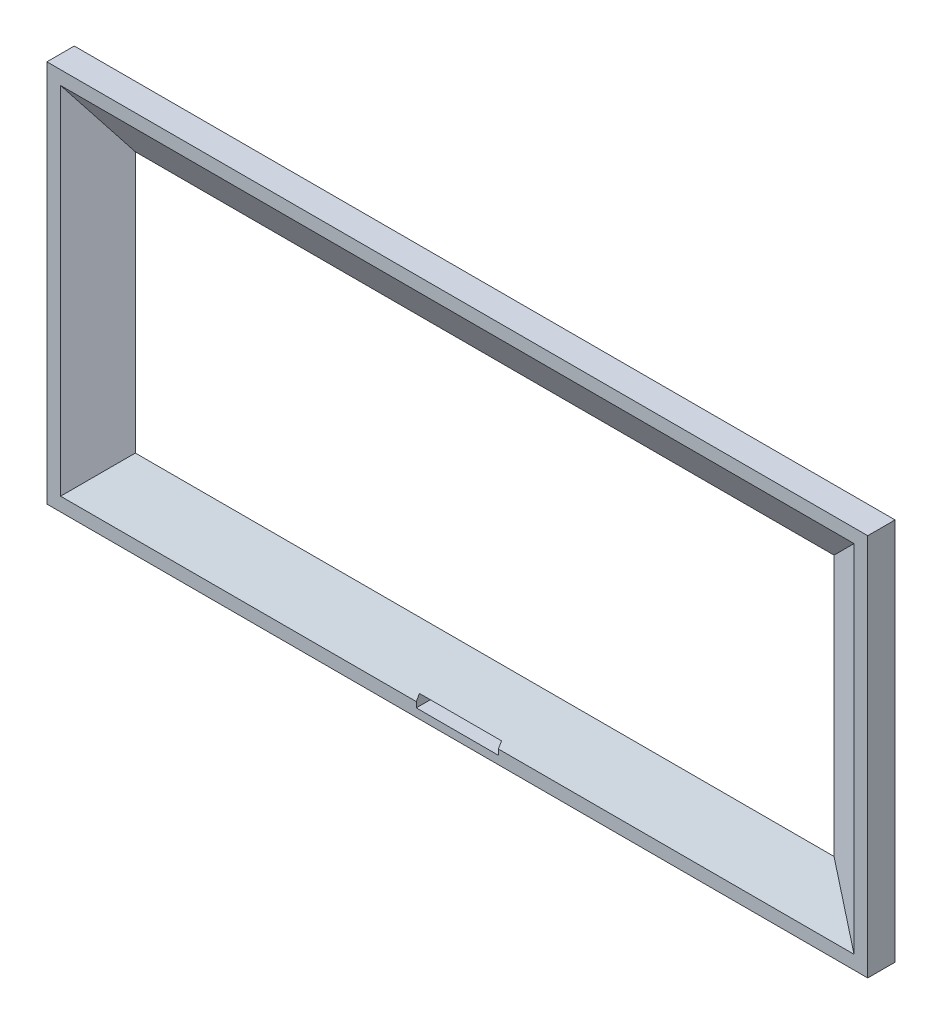
from build123d import *

# Parameters (mm, degrees)
SKETCH1_W           = 300
SKETCH1_H           = 140
SKETCH1_W_2         = 250
SKETCH1_H_2         = 90
BOSS_EXTRUDE1_DEPTH = 10
SKETCH2_W           = 30
SKETCH2_H           = 4
CUT_EXTRUDE1_DEPTH  = 44


with BuildPart() as part:
    # Sketch1 → Boss-Extrude1 (new body)
    with BuildSketch(Plane.XY):
        with Locations((125, 45)):
            Rectangle(SKETCH1_W, SKETCH1_H)
        with Locations((125, 45)):
            Rectangle(SKETCH1_W_2, SKETCH1_H_2, mode=Mode.SUBTRACT)
    extrude(amount=BOSS_EXTRUDE1_DEPTH)

    # Chamfer1
    # the kernel refuses this chamfer: 20, 11.547005384 mm, written as the material it takes off along each edge
    with BuildSketch(Plane(origin=(250, 0, 10), x_dir=(-0.05789386240267053, 0, -0.9983227437537926), z_dir=(0, 1, 0)), Plane(origin=(0, 90, 10), x_dir=(0.05789386240267081, 0, -0.9983227437537926), z_dir=(0, -1, 0))) as chamfer1_piece_1:
        with BuildLine():
            Line((11.967077239, 0), (-1.59731639, -20.634955616))
            Line((-1.59731639, -20.634955616), (-1.996645488, -20.611798071))
            ThreePointArc((-1.996645488, -20.611798071), (-0.998322744, -10.305899035), (-0.399329098, 0.023157545))
            Line((-0.399329098, 0.023157545), (0.023157545, 0.399329098))
            ThreePointArc((0.023157545, 0.399329098), (5.986641142, 0.053499955), (11.990234784, 0.399329098))
            Line((11.990234784, 0.399329098), (11.967077239, 0))
        make_face()
    extrude(amount=90, mode=Mode.SUBTRACT)
    with BuildSketch(Plane(origin=(250, 90, 10), x_dir=(0, -0.05789386240267053, -0.9983227437537926), z_dir=(-1, 0, 0)), Plane(origin=(0, 0, 10), x_dir=(0, 0.05789386240267081, -0.9983227437537926), z_dir=(1, 0, 0))) as chamfer1_piece_2:
        with BuildLine():
            Line((11.967077239, 0), (-1.59731639, -20.634955616))
            Line((-1.59731639, -20.634955616), (-1.996645488, -20.611798071))
            ThreePointArc((-1.996645488, -20.611798071), (-0.998322744, -10.305899035), (-0.399329098, 0.023157545))
            Line((-0.399329098, 0.023157545), (0.023157545, 0.399329098))
            ThreePointArc((0.023157545, 0.399329098), (5.986641142, 0.053499955), (11.990234784, 0.399329098))
            Line((11.990234784, 0.399329098), (11.967077239, 0))
        make_face()
    extrude(amount=250, mode=Mode.SUBTRACT)
    with BuildSketch(Plane(origin=(250, -51.741715093, 10), x_dir=(-0.05789386240267053, 0, -0.9983227437537926), z_dir=(0, 1, 0))) as chamfer1_piece_3a_section:
        with BuildLine():
            Line((11.967077239, 0), (-1.59731639, -20.634955616))
            Line((-1.59731639, -20.634955616), (-1.996645488, -20.611798071))
            ThreePointArc((-1.996645488, -20.611798071), (-0.998322744, -10.305899035), (-0.399329098, 0.023157545))
            Line((-0.399329098, 0.023157545), (0.023157545, 0.399329098))
            ThreePointArc((0.023157545, 0.399329098), (5.986641142, 0.053499955), (11.990234784, 0.399329098))
            Line((11.990234784, 0.399329098), (11.967077239, 0))
        make_face()
    chamfer1_piece_3a = extrude(amount=141.741715093, mode=Mode.PRIVATE)
    chamfer1_piece_3a = split(chamfer1_piece_3a, bisect_by=Plane(origin=(256.707645432, 0, 6.297222994), z_dir=(0, -1, 0)), keep=Keep.TOP, mode=Mode.PRIVATE)
    with BuildSketch(Plane(origin=(0, 0, 10), x_dir=(0, 0.05789386240267081, -0.9983227437537926), z_dir=(1, 0, 0))) as chamfer1_piece_3b_section:
        with BuildLine():
            Line((11.967077239, 0), (-1.59731639, -20.634955616))
            Line((-1.59731639, -20.634955616), (-1.996645488, -20.611798071))
            ThreePointArc((-1.996645488, -20.611798071), (-0.998322744, -10.305899035), (-0.399329098, 0.023157545))
            Line((-0.399329098, 0.023157545), (0.023157545, 0.399329098))
            ThreePointArc((0.023157545, 0.399329098), (5.986641142, 0.053499955), (11.990234784, 0.399329098))
            Line((11.990234784, 0.399329098), (11.967077239, 0))
        make_face()
    chamfer1_piece_3b = extrude(amount=301.741715093, mode=Mode.PRIVATE)
    chamfer1_piece_3b = split(chamfer1_piece_3b, bisect_by=Plane(origin=(250, -6.707645432, 6.297222994), z_dir=(1, 0, 0)), keep=Keep.TOP, mode=Mode.PRIVATE)
    chamfer1_piece_3 = chamfer1_piece_3a & chamfer1_piece_3b
    add(chamfer1_piece_3, mode=Mode.SUBTRACT)
    with BuildSketch(Plane(origin=(301.741715093, 90, 10), x_dir=(0, -0.05789386240267053, -0.9983227437537926), z_dir=(-1, 0, 0))) as chamfer1_piece_4a_section:
        with BuildLine():
            Line((11.967077239, 0), (-1.59731639, -20.634955616))
            Line((-1.59731639, -20.634955616), (-1.996645488, -20.611798071))
            ThreePointArc((-1.996645488, -20.611798071), (-0.998322744, -10.305899035), (-0.399329098, 0.023157545))
            Line((-0.399329098, 0.023157545), (0.023157545, 0.399329098))
            ThreePointArc((0.023157545, 0.399329098), (5.986641142, 0.053499955), (11.990234784, 0.399329098))
            Line((11.990234784, 0.399329098), (11.967077239, 0))
        make_face()
    chamfer1_piece_4a = extrude(amount=301.741715093, mode=Mode.PRIVATE)
    chamfer1_piece_4a = split(chamfer1_piece_4a, bisect_by=Plane(origin=(250, 96.707645432, 6.297222994), z_dir=(1, 0, 0)), keep=Keep.TOP, mode=Mode.PRIVATE)
    with BuildSketch(Plane(origin=(250, 0, 10), x_dir=(-0.05789386240267053, 0, -0.9983227437537926), z_dir=(0, 1, 0))) as chamfer1_piece_4b_section:
        with BuildLine():
            Line((11.967077239, 0), (-1.59731639, -20.634955616))
            Line((-1.59731639, -20.634955616), (-1.996645488, -20.611798071))
            ThreePointArc((-1.996645488, -20.611798071), (-0.998322744, -10.305899035), (-0.399329098, 0.023157545))
            Line((-0.399329098, 0.023157545), (0.023157545, 0.399329098))
            ThreePointArc((0.023157545, 0.399329098), (5.986641142, 0.053499955), (11.990234784, 0.399329098))
            Line((11.990234784, 0.399329098), (11.967077239, 0))
        make_face()
    chamfer1_piece_4b = extrude(amount=141.741715093, mode=Mode.PRIVATE)
    chamfer1_piece_4b = split(chamfer1_piece_4b, bisect_by=Plane(origin=(256.707645432, 90, 6.297222994), z_dir=(0, 1, 0)), keep=Keep.TOP, mode=Mode.PRIVATE)
    chamfer1_piece_4 = chamfer1_piece_4a & chamfer1_piece_4b
    add(chamfer1_piece_4, mode=Mode.SUBTRACT)
    with BuildSketch(Plane(origin=(0, 141.741715093, 10), x_dir=(0.05789386240267081, 0, -0.9983227437537926), z_dir=(0, -1, 0))) as chamfer1_piece_5a_section:
        with BuildLine():
            Line((11.967077239, 0), (-1.59731639, -20.634955616))
            Line((-1.59731639, -20.634955616), (-1.996645488, -20.611798071))
            ThreePointArc((-1.996645488, -20.611798071), (-0.998322744, -10.305899035), (-0.399329098, 0.023157545))
            Line((-0.399329098, 0.023157545), (0.023157545, 0.399329098))
            ThreePointArc((0.023157545, 0.399329098), (5.986641142, 0.053499955), (11.990234784, 0.399329098))
            Line((11.990234784, 0.399329098), (11.967077239, 0))
        make_face()
    chamfer1_piece_5a = extrude(amount=141.741715093, mode=Mode.PRIVATE)
    chamfer1_piece_5a = split(chamfer1_piece_5a, bisect_by=Plane(origin=(-6.707645432, 90, 6.297222994), z_dir=(0, 1, 0)), keep=Keep.TOP, mode=Mode.PRIVATE)
    with BuildSketch(Plane(origin=(250, 90, 10), x_dir=(0, -0.05789386240267053, -0.9983227437537926), z_dir=(-1, 0, 0))) as chamfer1_piece_5b_section:
        with BuildLine():
            Line((11.967077239, 0), (-1.59731639, -20.634955616))
            Line((-1.59731639, -20.634955616), (-1.996645488, -20.611798071))
            ThreePointArc((-1.996645488, -20.611798071), (-0.998322744, -10.305899035), (-0.399329098, 0.023157545))
            Line((-0.399329098, 0.023157545), (0.023157545, 0.399329098))
            ThreePointArc((0.023157545, 0.399329098), (5.986641142, 0.053499955), (11.990234784, 0.399329098))
            Line((11.990234784, 0.399329098), (11.967077239, 0))
        make_face()
    chamfer1_piece_5b = extrude(amount=301.741715093, mode=Mode.PRIVATE)
    chamfer1_piece_5b = split(chamfer1_piece_5b, bisect_by=Plane(origin=(0, 96.707645432, 6.297222994), z_dir=(-1, 0, 0)), keep=Keep.TOP, mode=Mode.PRIVATE)
    chamfer1_piece_5 = chamfer1_piece_5a & chamfer1_piece_5b
    add(chamfer1_piece_5, mode=Mode.SUBTRACT)
    with BuildSketch(Plane(origin=(0, 90, 10), x_dir=(0.05789386240267081, 0, -0.9983227437537926), z_dir=(0, -1, 0))) as chamfer1_piece_6a_section:
        with BuildLine():
            Line((11.967077239, 0), (-1.59731639, -20.634955616))
            Line((-1.59731639, -20.634955616), (-1.996645488, -20.611798071))
            ThreePointArc((-1.996645488, -20.611798071), (-0.998322744, -10.305899035), (-0.399329098, 0.023157545))
            Line((-0.399329098, 0.023157545), (0.023157545, 0.399329098))
            ThreePointArc((0.023157545, 0.399329098), (5.986641142, 0.053499955), (11.990234784, 0.399329098))
            Line((11.990234784, 0.399329098), (11.967077239, 0))
        make_face()
    chamfer1_piece_6a = extrude(amount=141.741715093, mode=Mode.PRIVATE)
    chamfer1_piece_6a = split(chamfer1_piece_6a, bisect_by=Plane(origin=(-6.707645432, 0, 6.297222994), z_dir=(0, -1, 0)), keep=Keep.TOP, mode=Mode.PRIVATE)
    with BuildSketch(Plane(origin=(-51.741715093, 0, 10), x_dir=(0, 0.05789386240267081, -0.9983227437537926), z_dir=(1, 0, 0))) as chamfer1_piece_6b_section:
        with BuildLine():
            Line((11.967077239, 0), (-1.59731639, -20.634955616))
            Line((-1.59731639, -20.634955616), (-1.996645488, -20.611798071))
            ThreePointArc((-1.996645488, -20.611798071), (-0.998322744, -10.305899035), (-0.399329098, 0.023157545))
            Line((-0.399329098, 0.023157545), (0.023157545, 0.399329098))
            ThreePointArc((0.023157545, 0.399329098), (5.986641142, 0.053499955), (11.990234784, 0.399329098))
            Line((11.990234784, 0.399329098), (11.967077239, 0))
        make_face()
    chamfer1_piece_6b = extrude(amount=301.741715093, mode=Mode.PRIVATE)
    chamfer1_piece_6b = split(chamfer1_piece_6b, bisect_by=Plane(origin=(0, -6.707645432, 6.297222994), z_dir=(-1, 0, 0)), keep=Keep.TOP, mode=Mode.PRIVATE)
    chamfer1_piece_6 = chamfer1_piece_6a & chamfer1_piece_6b
    add(chamfer1_piece_6, mode=Mode.SUBTRACT)

    # Sketch2 → Cut-Extrude1 (cut)
    with BuildSketch(Plane.XY.offset(10)):
        with Locations((125, -20)):
            Rectangle(SKETCH2_W, SKETCH2_H)
    extrude(amount=-CUT_EXTRUDE1_DEPTH, mode=Mode.SUBTRACT)


solid = part.part
